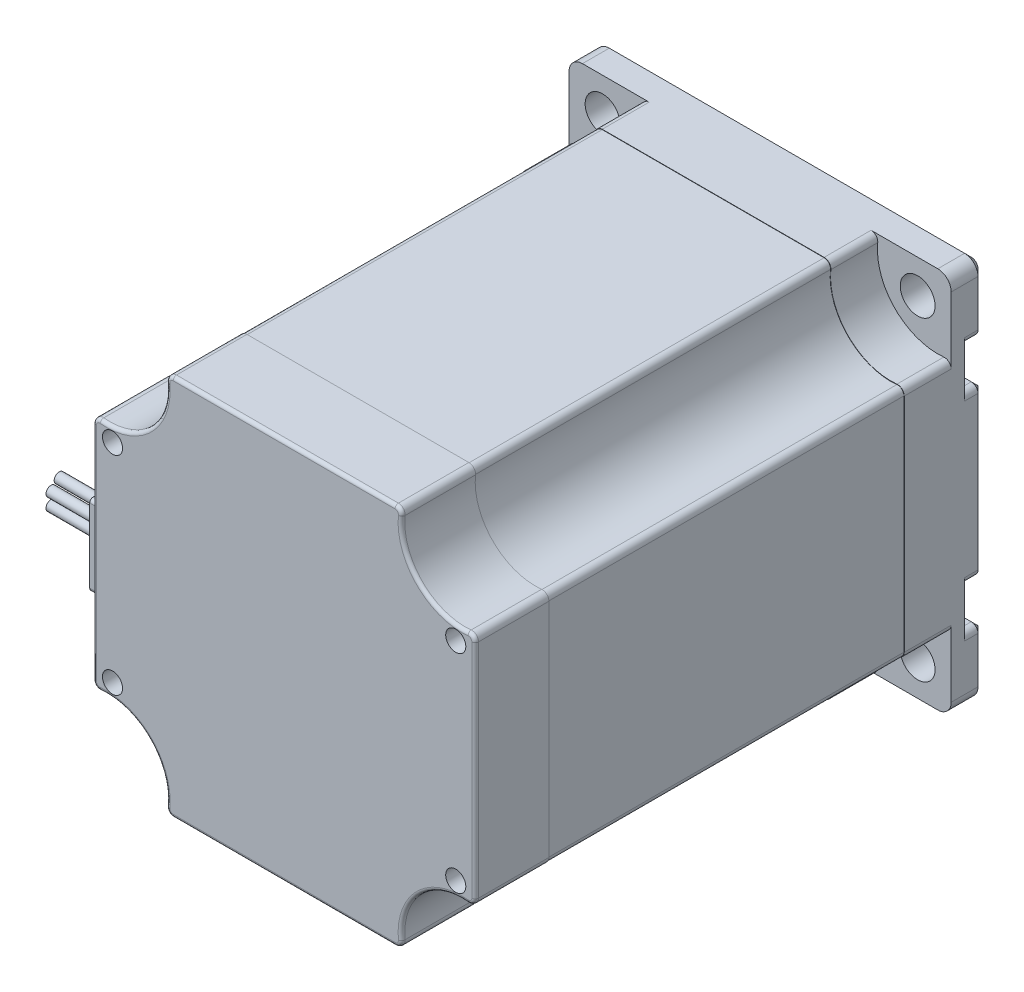
from build123d import *

# Parameters (mm, degrees)
BOSS_EXTRU_1_DEPTH           = 76
ENL_V_MAT_EXTRU_1_DEPTH      = 71
R_P_TITION_CIRCULAIRE1_COUNT = 4
ESQUISSE3_R                  = 2.6
ENL_V_MAT_EXTRU_2_DEPTH      = 5
ESQUISSE4_W                  = 65
ESQUISSE4_H                  = 65
ENL_V_MAT_EXTRU_3_DEPTH      = 53
ESQUISSE5_R                  = 3
BOSS_EXTRU_2_DEPTH           = 1
ENL_V_START                  = -5
ESQUISSE6_R                  = 3
ENL_V_MAT_EXTRU_4_DEPTH      = 5
ESQUISSE7_R                  = 0.75
BOSS_EXTRU_4_DEPTH           = 15
ENL_V_MAT_EXTRU_5_DEPTH      = 3
CONG_1_R                     = 1
CONG_1_OF_SYM_TRIE1_R        = 1
SYM_TRIE3_DEPTH              = 3
CHANFREIN1_SIZE              = 1
ESQUISSE9_R                  = 1.5
ENL_V_MAT_EXTRU_6_DEPTH      = 73
ESQUISSE10_R                 = 19
BOSS_EXTRU_5_DEPTH           = 1.6
ESQUISSE11_R                 = 5.5
ENL_V_MAT_EXTRU_7_DEPTH      = 5
BOSS_EXTRU_6_DEPTH           = 21
BOSS_EXTRU_6_DEPTH_BACK      = 76
ESQUISSE12_R                 = 3.175
CHANFREIN2_SIZE              = 1
CHANFREIN2_SIZE2             = 4.010780934
ENL_V_START_2                = 15
ENL_V_MAT_EXTRU_8_DEPTH      = 15
CHANFREIN3_SIZE              = 0.5
CHANFREIN3_SIZE2             = 0.288675135
CONG_2_R                     = 0.5


# Read off the part's stored shape, not the designer's step: Symétrie3
with BuildPart() as part:
    # Esquisse1 → Boss.-Extru.1 (new body)
    with BuildSketch(Plane.XY):
        with BuildLine():
            Line((-26.5, 28.5), (26.5, 28.5))
            ThreePointArc((26.5, 28.5), (27.914213562, 27.914213562), (28.5, 26.5))
            Line((28.5, 26.5), (28.5, -26.5))
            ThreePointArc((28.5, -26.5), (27.914213562, -27.914213562), (26.5, -28.5))
            Line((26.5, -28.5), (-26.5, -28.5))
            ThreePointArc((-26.5, -28.5), (-27.914213562, -27.914213562), (-28.5, -26.5))
            Line((-28.5, -26.5), (-28.5, 26.5))
            ThreePointArc((-28.5, 26.5), (-27.914213562, 27.914213562), (-26.5, 28.5))
        make_face()
    extrude(amount=BOSS_EXTRU_1_DEPTH)

    # Esquisse2 → Enlèv. mat.-Extru.1 (cut)
    with BuildSketch(Plane.XY.offset(76)):
        with BuildLine():
            Line((-28.5, 16.550125629), (-28.5, 12.320447857))
            Line((-28.5, 12.320447857), (-29.5, 12.320447857))
            Line((-29.5, 12.320447857), (-29.5, 29.5))
            Line((-29.5, 29.5), (-15.374641157, 29.5))
            Line((-15.374641157, 29.5), (-15.374641157, 28.5))
            Line((-15.374641157, 28.5), (-16.550125629, 28.5))
            ThreePointArc((-16.550125629, 28.5), (-17.291745478, 28.170820393), (-17.545113066, 27.4))
            ThreePointArc((-17.545113066, 27.4), (-20.136038969, 20.136038969), (-27.4, 17.545113066))
            ThreePointArc((-27.4, 17.545113066), (-28.170820393, 17.291745478), (-28.5, 16.550125629))
        make_face()
    enl_v_mat_extru_1 = extrude(amount=-ENL_V_MAT_EXTRU_1_DEPTH, mode=Mode.SUBTRACT)

    # Répétition circulaire1: Enlèv. mat.-Extru.1 ×4 about axis
    r_p_tition_circulaire1_axis = Axis((0, 0, 0), (0, 0, 1))
    for i in range(1, R_P_TITION_CIRCULAIRE1_COUNT):
        add(enl_v_mat_extru_1.rotate(r_p_tition_circulaire1_axis, i * 360 / R_P_TITION_CIRCULAIRE1_COUNT), mode=Mode.SUBTRACT)

    # Esquisse3 → Enlèv. mat.-Extru.2 (cut)
    with BuildSketch(Plane.XY.offset(5)):
        with Locations((-23.5, 23.5)):
            Circle(ESQUISSE3_R)
        with Locations((23.5, 23.5)):
            Circle(ESQUISSE3_R)
        with Locations((-23.5, -23.5)):
            Circle(ESQUISSE3_R)
        with Locations((23.5, -23.5)):
            Circle(ESQUISSE3_R)
    extrude(amount=-ENL_V_MAT_EXTRU_2_DEPTH, mode=Mode.SUBTRACT)

    # Esquisse4 → Enlèv. mat.-Extru.3 (cut)
    with BuildSketch(Plane.XY.offset(65)):
        Rectangle(ESQUISSE4_W, ESQUISSE4_H)
        with BuildLine():
            Line((-16.550125629, -28.45), (16.550125629, -28.45))
            ThreePointArc((16.550125629, -28.45), (17.254664485, -28.137279374), (17.495363694, -27.405))
            ThreePointArc((17.495363694, -27.405), (20.10068363, -20.10068363), (27.405, -17.495363694))
            ThreePointArc((27.405, -17.495363694), (28.137279374, -17.254664485), (28.45, -16.550125629))
            Line((28.45, -16.550125629), (28.45, 16.550125629))
            ThreePointArc((28.45, 16.550125629), (28.137279374, 17.254664485), (27.405, 17.495363694))
            ThreePointArc((27.405, 17.495363694), (20.10068363, 20.10068363), (17.495363694, 27.405))
            ThreePointArc((17.495363694, 27.405), (17.254664485, 28.137279374), (16.550125629, 28.45))
            Line((16.550125629, 28.45), (-16.550125629, 28.45))
            ThreePointArc((-16.550125629, 28.45), (-17.254664485, 28.137279374), (-17.495363694, 27.405))
            ThreePointArc((-17.495363694, 27.405), (-20.10068363, 20.10068363), (-27.405, 17.495363694))
            ThreePointArc((-27.405, 17.495363694), (-28.137279374, 17.254664485), (-28.45, 16.550125629))
            Line((-28.45, 16.550125629), (-28.45, -16.550125629))
            ThreePointArc((-28.45, -16.550125629), (-28.137279374, -17.254664485), (-27.405, -17.495363694))
            ThreePointArc((-27.405, -17.495363694), (-20.10068363, -20.10068363), (-17.495363694, -27.405))
            ThreePointArc((-17.495363694, -27.405), (-17.254664485, -28.137279374), (-16.550125629, -28.45))
        make_face(mode=Mode.SUBTRACT)
    extrude(amount=-ENL_V_MAT_EXTRU_3_DEPTH, mode=Mode.SUBTRACT)

    # Esquisse5 → Boss.-Extru.2 (add)
    with BuildSketch(Plane.ZY.offset(28.5)):
        with BuildLine():
            Line((65.6, 6), (75, 6))
            ThreePointArc((75, 6), (75.353553391, 5.853553391), (75.5, 5.5))
            Line((75.5, 5.5), (75.5, -5.5))
            ThreePointArc((75.5, -5.5), (75.353553391, -5.853553391), (75, -6))
            Line((75, -6), (65.6, -6))
            ThreePointArc((65.6, -6), (65.246446609, -5.853553391), (65.1, -5.5))
            Line((65.1, -5.5), (65.1, 5.5))
            ThreePointArc((65.1, 5.5), (65.246446609, 5.853553391), (65.6, 6))
        make_face()
        with Locations(Location((70.3, 0, 0), (0, 0, 270))):
            Circle(ESQUISSE5_R, mode=Mode.SUBTRACT)
    extrude(amount=BOSS_EXTRU_2_DEPTH)

    # Esquisse6 → Enlèv. mat.-Extru.4 (cut)
    with BuildSketch(Plane.ZY.offset(28.5).offset(ENL_V_START)):
        with Locations(Location((70.3, 0, 0), (0, 0, 270))):
            Circle(ESQUISSE6_R)
    extrude(amount=ENL_V_MAT_EXTRU_4_DEPTH, mode=Mode.SUBTRACT)

    # Esquisse7 → Boss.-Extru.4 (add)
    with BuildSketch(Plane.ZY.offset(23.5)):
        with Locations(Location((71.05, -2.041598638, 0), (0, 0, 270))):
            Circle(ESQUISSE7_R)
        with Locations(Location((71.05, 2.041598638, 0), (0, 0, 270))):
            Circle(ESQUISSE7_R)
        with Locations(Location((72.271219437, -0.919194719, 0), (0, 0, 270))):
            Circle(ESQUISSE7_R)
        with Locations(Location((72.271219437, 0.919194719, 0), (0, 0, 270))):
            Circle(ESQUISSE7_R)
    extrude(amount=BOSS_EXTRU_4_DEPTH)

    # Esquisse8 → Enlèv. mat.-Extru.5 (cut)
    with BuildSketch(Plane(origin=(0, 0, 0), x_dir=(-1, 0, 0), z_dir=(0, 0, -1))):
        with BuildLine():
            Line((-28.5, -12.4), (-25.6, -12.4))
            ThreePointArc((-25.6, -12.4), (-22.5, -15.5), (-25.6, -18.6))
            Line((-25.6, -18.6), (-28.5, -18.6))
            ThreePointArc((-28.5, -18.6), (-31.6, -15.5), (-28.5, -12.4))
        make_face()
    enl_v_mat_extru_5 = extrude(amount=-ENL_V_MAT_EXTRU_5_DEPTH, mode=Mode.SUBTRACT)

    # Congé1
    cong_1_edges = [part.edges().sort_by_distance(p)[0] for p in [
        (28.5, -18.6, 1.5),
        (28.5, -12.4, 1.5),
    ]]
    fillet(cong_1_edges, radius=CONG_1_R)

    # Symétrie1: Enlèv. mat.-Extru.5 across plane
    add(enl_v_mat_extru_5.mirror(Plane.ZX), mode=Mode.SUBTRACT)

    # Congé1 of Symétrie1
    cong_1_of_sym_trie1_edges = [part.edges().sort_by_distance(p)[0] for p in [
        (28.5, 18.6, 1.5),
        (28.5, 12.4, 1.5),
    ]]
    fillet(cong_1_of_sym_trie1_edges, radius=CONG_1_OF_SYM_TRIE1_R)

    # Symétrie3 outline → Symétrie3 (cut)
    with BuildSketch(Plane.XY):
        with BuildLine():
            ThreePointArc((-25.6, -18.6), (-22.5, -15.5), (-25.6, -12.4))
            Line((-25.6, -12.4), (-27.5, -12.4))
            ThreePointArc((-27.5, -12.4), (-28.207106781, -12.107106781), (-28.5, -11.4))
            Line((-28.5, -11.4), (-28.5, -19.6))
            ThreePointArc((-28.5, -19.6), (-28.207106781, -18.892893219), (-27.5, -18.6))
            Line((-27.5, -18.6), (-25.6, -18.6))
        make_face()
        with BuildLine():
            Line((-28.5, 19.6), (-28.5, 11.4))
            ThreePointArc((-28.5, 11.4), (-28.207106781, 12.107106781), (-27.5, 12.4))
            Line((-27.5, 12.4), (-25.6, 12.4))
            ThreePointArc((-25.6, 12.4), (-22.5, 15.5), (-25.6, 18.6))
            Line((-25.6, 18.6), (-27.5, 18.6))
            ThreePointArc((-27.5, 18.6), (-28.207106781, 18.892893219), (-28.5, 19.6))
        make_face()
    extrude(amount=SYM_TRIE3_DEPTH, mode=Mode.SUBTRACT)

    # Chanfrein1
    chanfrein1_edges = [part.edges().sort_by_distance(p)[0] for p in [
        (28.5, -23.05, 0),
        (27.914213562, -27.914213562, 0),
        (0, -28.5, 0),
        (-27.914213562, -27.914213562, 0),
        (26.55, -12.4, 0),
        (22.5, -15.5, 0),
        (26.55, -18.6, 0),
        (28.5, 0, 0),
        (28.207106781, -12.107106781, 0),
        (28.207106781, -18.892893219, 0),
        (22.5, 15.5, 0),
        (26.55, 12.4, 0),
        (28.5, 23.05, 0),
        (26.55, 18.6, 0),
        (28.207106781, 12.107106781, 0),
        (28.207106781, 18.892893219, 0),
        (-28.5, 0, 0),
        (-28.5, -23.05, 0),
        (-28.207106781, -12.107106781, 0),
        (-28.207106781, -18.892893219, 0),
        (-26.55, -18.6, 0),
        (-22.5, -15.5, 0),
        (-26.55, -12.4, 0),
        (-26.55, 18.6, 0),
        (-22.5, 15.5, 0),
        (-26.55, 12.4, 0),
        (-28.207106781, 18.892893219, 0),
        (-28.207106781, 12.107106781, 0),
        (-28.5, 23.05, 0),
        (-27.914213562, 27.914213562, 0),
        (0, 28.5, 0),
        (27.914213562, 27.914213562, 0),
    ]]
    chamfer(chanfrein1_edges, length=CHANFREIN1_SIZE)

    # Esquisse9 → Enlèv. mat.-Extru.6 (cut)
    with BuildSketch(Plane(origin=(0, 0, 3), x_dir=(-1, 0, 0), z_dir=(0, 0, -1))):
        with Locations((-25.6, -15.5)):
            Circle(ESQUISSE9_R)
        with Locations((-25.6, 15.5)):
            Circle(ESQUISSE9_R)
        with Locations((25.6, 15.5)):
            Circle(ESQUISSE9_R)
        with Locations((25.6, -15.5)):
            Circle(ESQUISSE9_R)
    extrude(amount=-ENL_V_MAT_EXTRU_6_DEPTH, mode=Mode.SUBTRACT)

    # Esquisse10 → Boss.-Extru.5 (add)
    with BuildSketch(Plane(origin=(0, 0, 0), x_dir=(-1, 0, 0), z_dir=(0, 0, -1))):
        with Locations(Location((0, 0, 0), (0, 0, 180))):
            Circle(ESQUISSE10_R)
    extrude(amount=BOSS_EXTRU_5_DEPTH)

    # Esquisse11 → Enlèv. mat.-Extru.7 (cut)
    with BuildSketch(Plane(origin=(0, 0, -1.6), x_dir=(-1, 0, 0), z_dir=(0, 0, -1))):
        Circle(ESQUISSE11_R)
    extrude(amount=-ENL_V_MAT_EXTRU_7_DEPTH, mode=Mode.SUBTRACT)

    # Esquisse12 → Boss.-Extru.6 (add, two sides: drawn at the far end of the back side and taken through both)
    with BuildSketch(Plane(origin=(0, 0, 0), x_dir=(-1, 0, 0), z_dir=(0, 0, -1)).offset(-BOSS_EXTRU_6_DEPTH_BACK)):
        Circle(ESQUISSE12_R)
    extrude(amount=BOSS_EXTRU_6_DEPTH + BOSS_EXTRU_6_DEPTH_BACK)

    # Chanfrein2
    chanfrein2_edges = [part.edges().sort_by_distance(p)[0] for p in [
        (3.175, 0, 3.4),
    ]]
    chanfrein2_side = [part.faces().sort_by_distance(p)[0] for p in [
        (5.344436508, 0, 3.4),
    ]]
    chamfer(chanfrein2_edges, length=CHANFREIN2_SIZE, length2=CHANFREIN2_SIZE2, reference=chanfrein2_side[0])

    # Esquisse13 → Enlèv. mat.-Extru.8 (cut)
    with BuildSketch(Plane(origin=(0, 0, -6), x_dir=(-1, 0, 0), z_dir=(0, 0, -1)).offset(ENL_V_START_2)):
        with BuildLine():
            Line((-2.313006701, 2.175), (2.313006701, 2.175))
            ThreePointArc((2.313006701, 2.175), (0, 3.175), (-2.313006701, 2.175))
        make_face()
    extrude(amount=-ENL_V_MAT_EXTRU_8_DEPTH, mode=Mode.SUBTRACT)

    # Chanfrein3
    chanfrein3_edges = [part.edges().sort_by_distance(p)[0] for p in [
        (1.169792444, -2.951645412, -21),
    ]]
    chanfrein3_side = [part.faces().sort_by_distance(p)[0] for p in [
        (3.175, 0, -10.805390467),
    ]]
    chamfer(chanfrein3_edges, length=CHANFREIN3_SIZE, length2=CHANFREIN3_SIZE2, reference=chanfrein3_side[0])

    # Congé2
    cong_2_edges = [part.edges().sort_by_distance(p)[0] for p in [
        (28.170820393, 17.291745478, 76),
        (17.291745478, 28.170820393, 76),
        (20.136038969, 20.136038969, 76),
        (-28.5, 0, 76),
        (-17.291745478, 28.170820393, 76),
        (-28.170820393, 17.291745478, 76),
        (-20.136038969, 20.136038969, 76),
        (0, -28.5, 76),
        (28.5, 0, 76),
        (0, 28.5, 76),
        (-17.291745478, -28.170820393, 76),
        (-20.136038969, -20.136038969, 76),
        (-28.170820393, -17.291745478, 76),
        (17.291745478, -28.170820393, 76),
        (28.170820393, -17.291745478, 76),
        (20.136038969, -20.136038969, 76),
    ]]
    fillet(cong_2_edges, radius=CONG_2_R - 0.0001)  # a hair under: the kernel refuses the full size


solid = part.part
